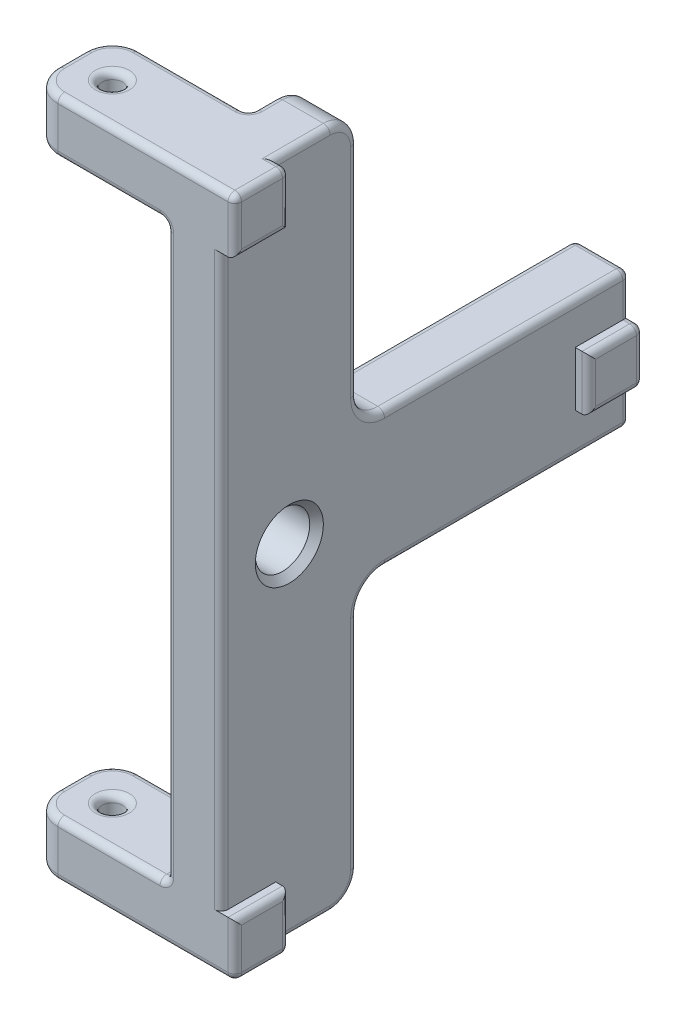
from build123d import *

# Parameters (mm, degrees)
BOSS_EXTRUDE1_DEPTH = 5
SKETCH2_3_W         = 6
SKETCH2_3_H         = 4
BOSS_EXTRUDE2_DEPTH = 10
SKETCH2_4_R         = 2
CUT_EXTRUDE1_DEPTH  = 10
FILLET1_R           = 2
SKETCH3_R           = 0.75
CUT_EXTRUDE3_DEPTH  = 50
CUT_EXTRUDE4_DEPTH  = 1
FILLET4_R           = 2
FILLET5_R           = 0.5
FILLET7_R           = 0.5
CHAMFER1_SIZE       = 0.5


with BuildPart() as part:
    # Sketch2 → Boss-Extrude1 (new body)
    with BuildSketch(Plane(origin=(0, 0, 0), x_dir=(0, 0, -1), z_dir=(1, 0, 0))):
        Polygon((-25, 25), (-25, -25), (-15, -25), (-15, -5), (5, -5), (5, 5), (-15, 5), (-15, 25), align=None)
    extrude(amount=BOSS_EXTRUDE1_DEPTH)

    # Sketch2<3> → Boss-Extrude2 (add)
    with BuildSketch(Plane(origin=(0, 0, 0), x_dir=(0, 0, -1), z_dir=(1, 0, 0))):
        with Locations((-22, 23)):
            Rectangle(SKETCH2_3_W, SKETCH2_3_H)
        with Locations((-22, -23)):
            Rectangle(SKETCH2_3_W, SKETCH2_3_H)
    extrude(amount=-BOSS_EXTRUDE2_DEPTH)

    # Sketch2<4> → Cut-Extrude1 (cut)
    with BuildSketch(Plane(origin=(0, 0, 0), x_dir=(0, 0, -1), z_dir=(1, 0, 0))):
        with Locations((-20, 0)):
            Circle(SKETCH2_4_R)
    extrude(amount=CUT_EXTRUDE1_DEPTH, mode=Mode.SUBTRACT)

    # Fillet1
    fillet1_edges = [part.edges().sort_by_distance(p)[0] for p in [
        (-10, 23, 25),
        (-10, 23, 19),
        (-10, -23, 25),
        (-10, -23, 19),
    ]]
    fillet(fillet1_edges, radius=FILLET1_R)

    # Sketch3 → Cut-Extrude3 (cut)
    with BuildSketch(Plane(origin=(0, 25, 0), x_dir=(1, 0, 0), z_dir=(0, 1, 0))):
        with Locations(Location((-7, -22, 0), (0, 0, 270))):
            Circle(SKETCH3_R)
    extrude(amount=-CUT_EXTRUDE3_DEPTH, mode=Mode.SUBTRACT)

    # Sketch4 → Cut-Extrude4 (cut)
    with BuildSketch(Plane(origin=(5, 0, 0), x_dir=(0, 0, -1), z_dir=(1, 0, 0))):
        Polygon((-15, 25), (-21, 25), (-21, 21), (-25, 21), (-25, -21), (-21, -21), (-21, -25), (-15, -25), (-15, -5), (5, -5), (5, -2), (1, -2), (1, 2), (5, 2), (5, 5), (-15, 5), align=None)
    extrude(amount=-CUT_EXTRUDE4_DEPTH, mode=Mode.SUBTRACT)

    # Fillet4
    fillet4_edges = [part.edges().sort_by_distance(p)[0] for p in [
        (2, -25, 15),
        (2, 25, 15),
        (2, 5, 15),
        (2, -5, 15),
    ]]
    fillet(fillet4_edges, radius=FILLET4_R)

    # Fillet5
    fillet5_edges = [part.edges().sort_by_distance(p)[0] for p in [
        (-7, 21, 21.25),
        (-7, -25, 21.25),
        (-7, -21, 21.25),
        (-7, 25, 21.25),
        (5, 0, -5),
        (5, -25, 23),
        (2, 5, -5),
        (2, -5, -5),
        (4, -3.5, -5),
        (4.5, -2, -5),
        (4, -25, 19),
        (4.5, -25, 21),
        (4, 0, 25),
        (4.5, 25, 21),
        (4, 5, 4),
        (4, 3.5, -5),
        (4.5, 2, -5),
        (0, 0, -5),
        (4, 25, 19),
        (0, 15, 15),
        (0, 5, 4),
        (0, -5, 4),
        (0, -15, 15),
        (0, -24.414213562, 15.585786438),
        (0, 24.414213562, 15.585786438),
        (4, 15, 15),
        (4, -15, 15),
        (4, -5, 4),
        (4, -24.414213562, 15.585786438),
        (4, 24.414213562, 15.585786438),
        (0, -5.585786438, 14.414213562),
        (4, -5.585786438, 14.414213562),
        (0, 5.585786438, 14.414213562),
        (4, 5.585786438, 14.414213562),
        (-1.5, -25, 25),
        (-1.5, 25, 25),
        (0, 0, 25),
        (0, 25, 18),
        (0, 23, 19),
        (0, 21, 22),
        (5, 25, 23),
        (0, -25, 18),
        (0, -21, 22),
        (0, -23, 19),
        (-4, -25, 19),
        (-4, -21, 19),
        (-10, -21, 22),
        (-9.414213562, -21, 24.414213562),
        (-9.414213562, -21, 19.585786438),
        (-10, -25, 22),
        (-9.414213562, -25, 24.414213562),
        (-9.414213562, -25, 19.585786438),
        (-10, 21, 22),
        (-10, 25, 22),
        (-4, 21, 19),
        (-9.414213562, 21, 24.414213562),
        (-9.414213562, 21, 19.585786438),
        (-4, 25, 19),
        (-9.414213562, 25, 24.414213562),
        (-9.414213562, 25, 19.585786438),
    ]]
    fillet(fillet5_edges, radius=FILLET5_R)

    # Fillet7
    # the kernel refuses this fillet: 0.5 mm, written as the material it takes off along each edge
    with BuildSketch(Plane(origin=(4.5, 1.5, -4.5), x_dir=(0, 1, 0), z_dir=(1, 0, 0))) as fillet7_piece_1_section:
        Polygon((0, 0), (FILLET7_R, 0), (FILLET7_R, -FILLET7_R), (0, -FILLET7_R), align=None)
    fillet7_piece_1 = extrude(amount=FILLET7_R, mode=Mode.PRIVATE)
    fillet7_piece_1 = fillet7_piece_1 - Plane(origin=(4.5, 1.5, -4.5), x_dir=(0, -0.7071067811865475, 0.7071067811865475), z_dir=(1, 0, 0)) * Sphere(FILLET7_R, mode=Mode.PRIVATE)
    add(fillet7_piece_1, mode=Mode.SUBTRACT)
    with BuildSketch(Plane(origin=(4.5, -1.5, -4.5), x_dir=(0, -1, 0), z_dir=(1, 0, 0))) as fillet7_piece_2_section:
        Polygon((0, 0), (FILLET7_R, 0), (FILLET7_R, FILLET7_R), (0, FILLET7_R), align=None)
    fillet7_piece_2 = extrude(amount=FILLET7_R, mode=Mode.PRIVATE)
    fillet7_piece_2 = fillet7_piece_2 - Plane(origin=(4.5, -1.5, -4.5), x_dir=(0, 0.7071067811865475, 0.7071067811865475), z_dir=(1, 0, 0)) * Sphere(FILLET7_R, mode=Mode.PRIVATE)
    add(fillet7_piece_2, mode=Mode.SUBTRACT)
    with BuildSketch(Plane(origin=(4.5, 24.5, 21.5), x_dir=(0, 0, -1), z_dir=(1, 0, 0))) as fillet7_piece_3_section:
        Polygon((0, 0), (FILLET7_R, 0), (FILLET7_R, FILLET7_R), (0, FILLET7_R), align=None)
    fillet7_piece_3 = extrude(amount=FILLET7_R, mode=Mode.PRIVATE)
    fillet7_piece_3 = fillet7_piece_3 - Plane(origin=(4.5, 24.5, 21.5), x_dir=(0, -0.7071067811865475, 0.7071067811865475), z_dir=(1, 0, 0)) * Sphere(FILLET7_R, mode=Mode.PRIVATE)
    add(fillet7_piece_3, mode=Mode.SUBTRACT)
    with BuildSketch(Plane(origin=(4.5, -24.5, 21.5), x_dir=(0, 0, -1), z_dir=(1, 0, 0))) as fillet7_piece_4_section:
        Polygon((0, 0), (FILLET7_R, 0), (FILLET7_R, -FILLET7_R), (0, -FILLET7_R), align=None)
    fillet7_piece_4 = extrude(amount=FILLET7_R, mode=Mode.PRIVATE)
    fillet7_piece_4 = fillet7_piece_4 - Plane(origin=(4.5, -24.5, 21.5), x_dir=(0, 0.7071067811865475, 0.7071067811865475), z_dir=(1, 0, 0)) * Sphere(FILLET7_R, mode=Mode.PRIVATE)
    add(fillet7_piece_4, mode=Mode.SUBTRACT)
    with BuildSketch(Plane(origin=(4.5, 24.5, 24.5), x_dir=(1, 0, 0), z_dir=(0, 0, 1))) as fillet7_piece_5_section:
        Polygon((0, 0), (FILLET7_R, 0), (FILLET7_R, FILLET7_R), (0, FILLET7_R), align=None)
    fillet7_piece_5 = extrude(amount=FILLET7_R, mode=Mode.PRIVATE)
    fillet7_piece_5 = fillet7_piece_5 - Plane(origin=(4.5, 24.5, 24.5), x_dir=(-0.7071067811865475, -0.7071067811865475, 0), z_dir=(0, 0, 1)) * Sphere(FILLET7_R, mode=Mode.PRIVATE)
    add(fillet7_piece_5, mode=Mode.SUBTRACT)
    with BuildSketch(Plane(origin=(4.5, -24.5, 24.5), x_dir=(1, 0, 0), z_dir=(0, 0, 1))) as fillet7_piece_6_section:
        Polygon((0, 0), (FILLET7_R, 0), (FILLET7_R, -FILLET7_R), (0, -FILLET7_R), align=None)
    fillet7_piece_6 = extrude(amount=FILLET7_R, mode=Mode.PRIVATE)
    fillet7_piece_6 = fillet7_piece_6 - Plane(origin=(4.5, -24.5, 24.5), x_dir=(-0.7071067811865475, 0.7071067811865475, 0), z_dir=(0, 0, 1)) * Sphere(FILLET7_R, mode=Mode.PRIVATE)
    add(fillet7_piece_6, mode=Mode.SUBTRACT)
    with BuildSketch(Plane(origin=(5, -19.75, 25), x_dir=(-1, 0, 0), z_dir=(0, -1, 0)), Plane(origin=(5, -2, -4.5), x_dir=(0, 1, 0), z_dir=(0, 0, 1)), Plane(origin=(5, 2, 0.25), x_dir=(0, -1, 0), z_dir=(0, 0, -1)), Plane(origin=(5, 24.5, 25), x_dir=(-1, 0, 0), z_dir=(0, -1, 0)), Plane(origin=(5, -19.75, 21), x_dir=(0, 0, 1), z_dir=(0, -1, 0)), Plane(origin=(5, 24.5, 21), x_dir=(0, 0, 1), z_dir=(0, -1, 0))) as fillet7_piece_7:
        with BuildLine():
            CenterArc((FILLET7_R, FILLET7_R), FILLET7_R, 180, 90)
            Line((0, FILLET7_R), (0, 0))
            Line((0, 0), (FILLET7_R, 0))
        make_face()
    extrude(amount=4.75, mode=Mode.SUBTRACT)
    with BuildSketch(Plane(origin=(5, 21, 19.75), x_dir=(0, 1, 0), z_dir=(0, 0, 1)), Plane(origin=(5, -3.25, -1), x_dir=(0, 0, -1), z_dir=(0, 1, 0)), Plane(origin=(5, -21, 26.25), x_dir=(0, -1, 0), z_dir=(0, 0, -1))) as fillet7_piece_8:
        with BuildLine():
            CenterArc((FILLET7_R, FILLET7_R), FILLET7_R, 180, 90)
            Line((0, FILLET7_R), (0, 0))
            Line((0, 0), (FILLET7_R, 0))
        make_face()
    extrude(amount=6.5, mode=Mode.SUBTRACT)

    # Chamfer1
    chamfer1_edges = [part.edges().sort_by_distance(p)[0] for p in [
        (4, 0, 22),
    ]]
    chamfer(chamfer1_edges, length=CHAMFER1_SIZE)


solid = part.part
